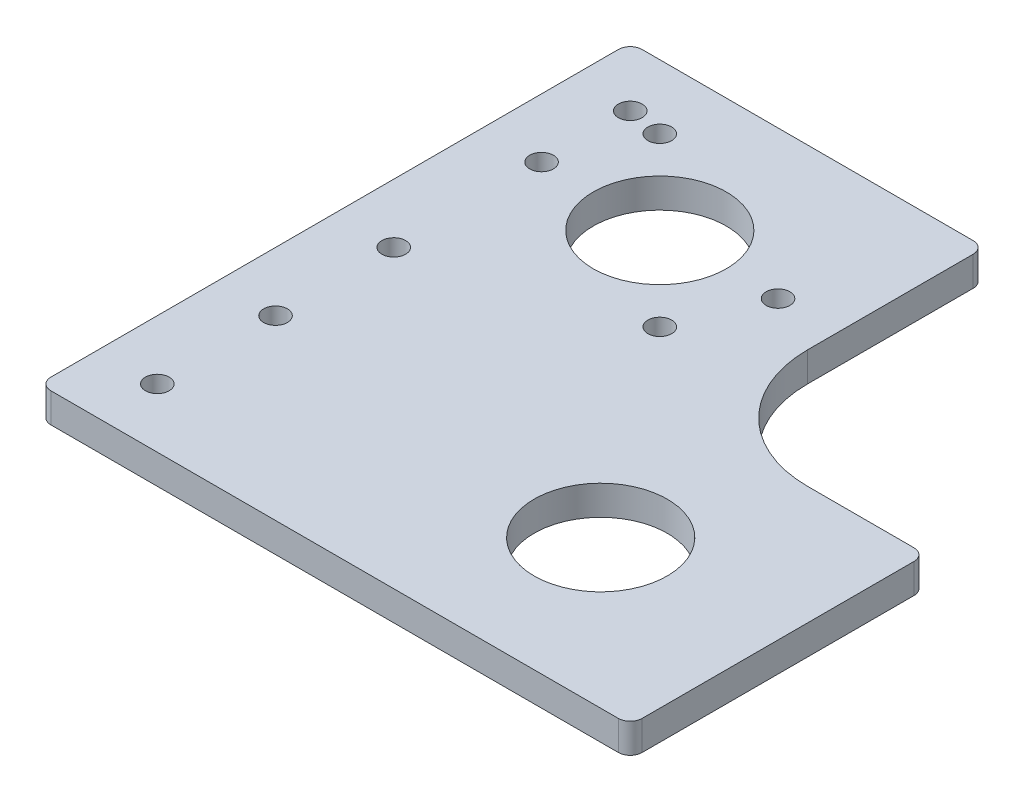
from build123d import *

# Parameters (mm, degrees)
SKETCH1_W           = 127
SKETCH1_H           = 127
BOSS_EXTRUDE1_DEPTH = 6.35
SKETCH2_W           = 50.8
SKETCH2_H           = 63.5
CUT_EXTRUDE1_DEPTH  = 180.717340566
SKETCH3_R           = 14.3002
CUT_EXTRUDE2_DEPTH  = 180.717340566
SKETCH5_R           = 2.5527
CUT_EXTRUDE4_DEPTH  = 180.717340566
CIRPATTERN1_COUNT   = 8
SKETCH6_R           = 14.3002
CUT_EXTRUDE5_DEPTH  = 180.717340566
FILLET1_R           = 2.54
FILLET2_R           = 25.4
SKETCH10_R          = 2.5527
CUT_EXTRUDE7_DEPTH  = 180.717340566
LPATTERN1_COUNT     = 5
LPATTERN1_PITCH     = 25.4


with BuildPart() as part:
    # Sketch1 → Boss-Extrude1 (new body)
    with BuildSketch(Plane(origin=(0, 0, 0), x_dir=(1, 0, 0), z_dir=(0, 1, 0))):
        with Locations((-63.5, 63.5)):
            Rectangle(SKETCH1_W, SKETCH1_H)
    extrude(amount=BOSS_EXTRUDE1_DEPTH)

    # Sketch2 → Cut-Extrude1 (cut, through all)
    with BuildSketch(Plane(origin=(0, 6.35, 0), x_dir=(1, 0, 0), z_dir=(0, 1, 0))):
        with Locations((-25.4, 95.25)):
            Rectangle(SKETCH2_W, SKETCH2_H)
    extrude(amount=-CUT_EXTRUDE1_DEPTH, mode=Mode.SUBTRACT)

    # Sketch3 → Cut-Extrude2 (cut, through all)
    with BuildSketch(Plane(origin=(0, 6.35, 0), x_dir=(1, 0, 0), z_dir=(0, 1, 0))):
        with Locations((-38.1, 31.75)):
            Circle(SKETCH3_R)
    extrude(amount=-CUT_EXTRUDE2_DEPTH, mode=Mode.SUBTRACT)

    # Sketch5 → Cut-Extrude4 (cut, through all)
    with BuildSketch(Plane(origin=(0, 6.35, 0), x_dir=(1, 0, 0), z_dir=(0, 1, 0))):
        with Locations((-114.3, 95.25)):
            Circle(SKETCH5_R)
    cut_extrude4 = extrude(amount=-CUT_EXTRUDE4_DEPTH, mode=Mode.SUBTRACT)

    # CirPattern1: Cut-Extrude4 ×8 about axis, 4 skipped
    cirpattern1_axis = Axis((-88.9, 6.35, -95.25), (0, 1, 0))
    add([cut_extrude4.rotate(cirpattern1_axis, i * 360 / CIRPATTERN1_COUNT) for i in range(1, CIRPATTERN1_COUNT) if i not in (1, 2, 5, 6)], mode=Mode.SUBTRACT)

    # Sketch6 → Cut-Extrude5 (cut, through all)
    with BuildSketch(Plane(origin=(0, 6.35, 0), x_dir=(1, 0, 0), z_dir=(0, 1, 0))):
        with Locations((-88.9, 95.25)):
            Circle(SKETCH6_R)
    extrude(amount=-CUT_EXTRUDE5_DEPTH, mode=Mode.SUBTRACT)

    # Fillet1
    fillet1_edges = [part.edges().sort_by_distance(p)[0] for p in [
        (-127, 3.175, 0),
        (0, 3.175, 0),
        (0, 3.175, -63.5),
        (-50.8, 3.175, -127),
        (-127, 3.175, -127),
    ]]
    fillet(fillet1_edges, radius=FILLET1_R)

    # Fillet2
    fillet2_edges = [part.edges().sort_by_distance(p)[0] for p in [
        (-50.8, 3.175, -63.5),
    ]]
    fillet(fillet2_edges, radius=FILLET2_R)

    # Sketch10 → Cut-Extrude7 (cut, through all)
    with BuildSketch(Plane(origin=(0, 6.35, 0), x_dir=(1, 0, 0), z_dir=(0, 1, 0))):
        with Locations((-114.3, 12.7)):
            Circle(SKETCH10_R)
    cut_extrude7 = extrude(amount=-CUT_EXTRUDE7_DEPTH, mode=Mode.SUBTRACT)

    # LPattern1: Cut-Extrude7 ×5, 1 skipped
    with Locations(*[(0, 0, -i * LPATTERN1_PITCH) for i in range(1, LPATTERN1_COUNT) if i not in (3,)]):
        add(cut_extrude7, mode=Mode.SUBTRACT)


solid = part.part
